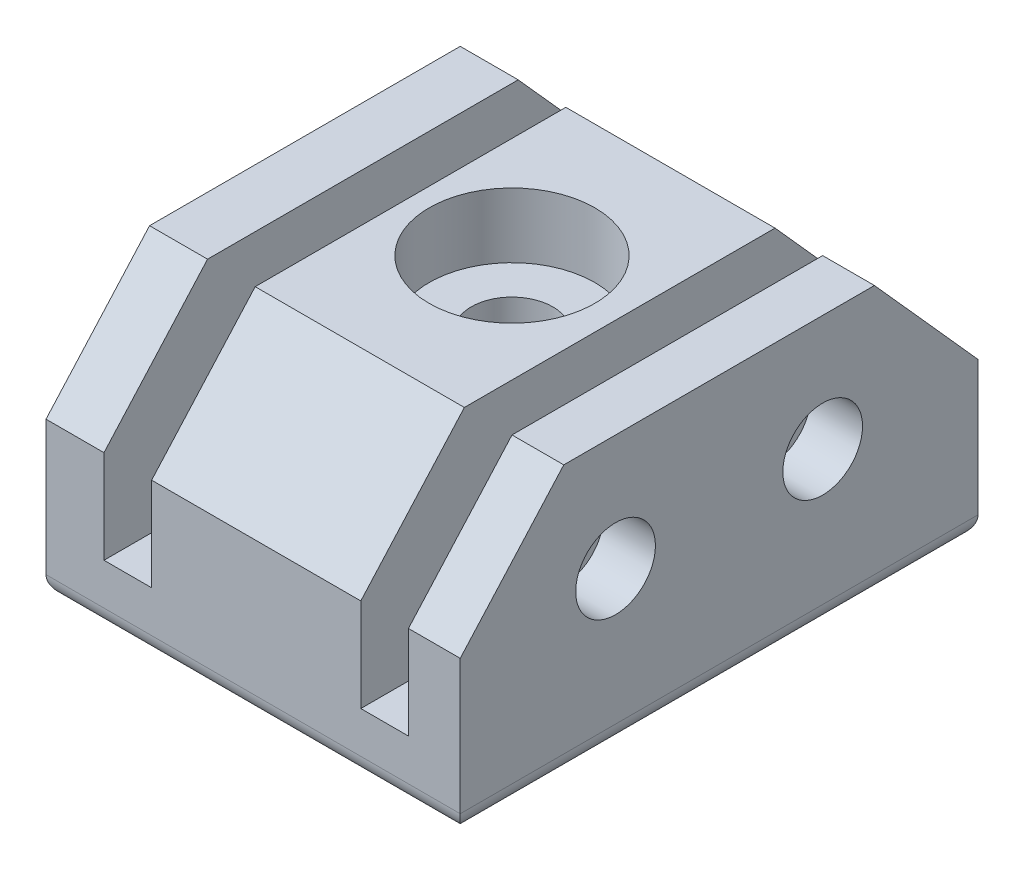
from build123d import *

# Parameters (mm, degrees)
SKETCH1_W           = 63.5
SKETCH1_H           = 6.35
BOSS_EXTRUDE1_DEPTH = 50.8
BOSS_EXTRUDE2_DEPTH = 50.8
SKETCH10_W          = 5.842
SKETCH10_H          = 25.629031657
CUT_EXTRUDE1_DEPTH  = 88.854357354
LPATTERN3_COUNT     = 2
LPATTERN3_PITCH     = 31.496
SKETCH11_R          = 4.8895
CUT_EXTRUDE2_DEPTH  = 88.854357354
FILLET1_R           = 2.54
SKETCH22_R          = 10.16
CUT_EXTRUDE8_DEPTH  = 7.9375
SKETCH24_R          = 5
CUT_EXTRUDE10_DEPTH = 88.854357354
CUT_EXTRUDE11_START = -2.54
SKETCH25_R          = 10.16
CUT_EXTRUDE11_DEPTH = 2.54


with BuildPart() as part:
    # Sketch1 → Boss-Extrude1 (new body)
    with BuildSketch(Plane(origin=(0, 0, 0), x_dir=(0, 0, -1), z_dir=(1, 0, 0))):
        with Locations((31.75, 3.175)):
            Rectangle(SKETCH1_W, SKETCH1_H)
    extrude(amount=-BOSS_EXTRUDE1_DEPTH)

    # Sketch2 → Boss-Extrude2 (add)
    with BuildSketch(Plane(origin=(0, 0, 0), x_dir=(0, 0, -1), z_dir=(1, 0, 0))):
        Polygon((0, 6.35), (0, 19.05), (12.7, 33.249031657), (50.8, 33.249031657), (63.5, 19.05), (63.5, 6.35), align=None)
    extrude(amount=-BOSS_EXTRUDE2_DEPTH)

    # Sketch10 → Cut-Extrude1 (cut, through all)
    with BuildSketch(Plane(origin=(0, 0, -63.5), x_dir=(-1, 0, 0), z_dir=(0, 0, -1))):
        with Locations((9.271, 20.434515829)):
            Rectangle(SKETCH10_W, SKETCH10_H)
    cut_extrude1 = extrude(amount=-CUT_EXTRUDE1_DEPTH, mode=Mode.SUBTRACT)

    # LPattern3: Cut-Extrude1 ×2
    with Locations(*[(-i * LPATTERN3_PITCH, 0, 0) for i in range(1, LPATTERN3_COUNT)]):
        add(cut_extrude1, mode=Mode.SUBTRACT)

    # Sketch11 → Cut-Extrude2 (cut, through all)
    with BuildSketch(Plane(origin=(0, 0, 0), x_dir=(0, 0, -1), z_dir=(1, 0, 0))):
        with Locations((19.05, 19.05)):
            Circle(SKETCH11_R)
        with Locations((44.45, 19.05)):
            Circle(SKETCH11_R)
    extrude(amount=-CUT_EXTRUDE2_DEPTH, mode=Mode.SUBTRACT)

    # Fillet1
    fillet1_edges = [part.edges().sort_by_distance(p)[0] for p in [
        (0, 0, -31.75),
        (-50.8, 0, -31.75),
        (-25.4, 0, 0),
        (-25.4, 0, -63.5),
    ]]
    fillet(fillet1_edges, radius=FILLET1_R)

    # Sketch22 → Cut-Extrude8 (cut)
    with BuildSketch(Plane.XZ.offset(-33.249031657)):
        with Locations((-25.4, -31.75)):
            Circle(SKETCH22_R)
    extrude(amount=CUT_EXTRUDE8_DEPTH, mode=Mode.SUBTRACT)

    # Sketch24 → Cut-Extrude10 (cut, through all)
    with BuildSketch(Plane.XZ):
        with Locations((-25.4, -31.75)):
            Circle(SKETCH24_R)
    extrude(amount=-CUT_EXTRUDE10_DEPTH, mode=Mode.SUBTRACT)

    # Sketch25 → Cut-Extrude11 (cut)
    with BuildSketch(Plane.XZ.offset(CUT_EXTRUDE11_START)):
        with Locations((-25.4, -31.75)):
            Circle(SKETCH25_R)
    extrude(amount=CUT_EXTRUDE11_DEPTH, mode=Mode.SUBTRACT)


solid = part.part
